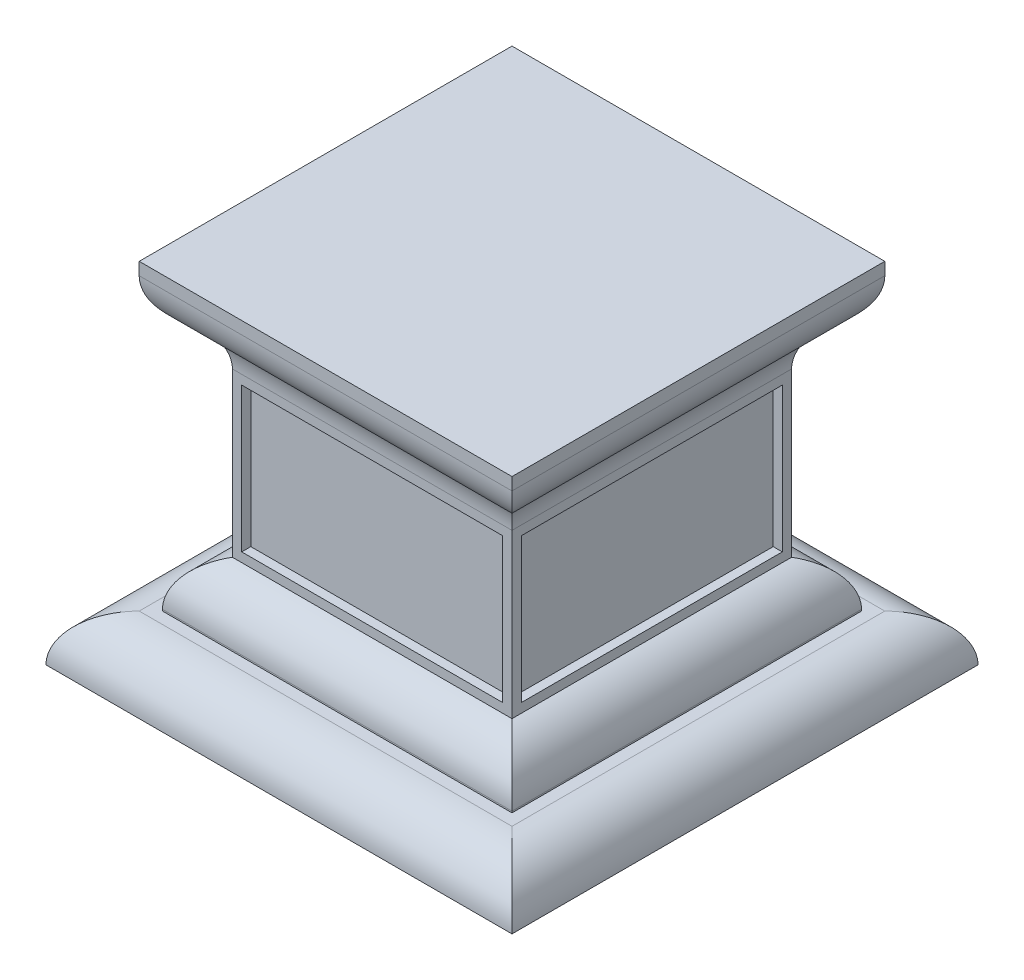
from build123d import *

# Parameters (mm, degrees)
SKETCH2_W           = 100
SKETCH2_H           = 100
BOSS_EXTRUDE1_DEPTH = 10
SKETCH3_W           = 75
SKETCH3_H           = 75
BOSS_EXTRUDE2_DEPTH = 10
SKETCH4_W           = 60
SKETCH4_H           = 60
BOSS_EXTRUDE3_DEPTH = 45
SKETCH5_W           = 80
SKETCH5_H           = 80
BOSS_EXTRUDE4_DEPTH = 10
FILLET2_R           = 10
FILLET1_R           = 10
FILLET3_R           = 10
SKETCH6_W           = 56
SKETCH6_H           = 31
CUT_EXTRUDE1_DEPTH  = 1.95
CIRPATTERN2_COUNT   = 4


# Some blends are built 0.0001 mm under size
with BuildPart() as part:
    # Sketch2 → Boss-Extrude1 (new body)
    with BuildSketch(Plane(origin=(0, 0, 0), x_dir=(1, 0, 0), z_dir=(0, 1, 0))):
        Rectangle(SKETCH2_W, SKETCH2_H)
    extrude(amount=BOSS_EXTRUDE1_DEPTH)

    # Sketch3 → Boss-Extrude2 (add)
    with BuildSketch(Plane(origin=(0, 10, 0), x_dir=(1, 0, 0), z_dir=(0, 1, 0))):
        Rectangle(SKETCH3_W, SKETCH3_H)
    extrude(amount=BOSS_EXTRUDE2_DEPTH)

    # Sketch4 → Boss-Extrude3 (add)
    with BuildSketch(Plane(origin=(0, 20, 0), x_dir=(1, 0, 0), z_dir=(0, 1, 0))):
        Rectangle(SKETCH4_W, SKETCH4_H)
    extrude(amount=BOSS_EXTRUDE3_DEPTH)

    # Sketch5 → Boss-Extrude4 (add)
    with BuildSketch(Plane(origin=(0, 65, 0), x_dir=(1, 0, 0), z_dir=(0, 1, 0))):
        Rectangle(SKETCH5_W, SKETCH5_H)
    extrude(amount=BOSS_EXTRUDE4_DEPTH)

    # Fillet2
    # the kernel refuses this fillet: 10 mm, written as the material it takes off along each edge
    with BuildSketch(Plane(origin=(-50, 10, 75), x_dir=(1, 0, 0), z_dir=(0, 0, -1)), Plane(origin=(75, 10, 50), x_dir=(0, 0, -1), z_dir=(-1, 0, 0)), Plane(origin=(-75, 10, -50), x_dir=(0, 0, 1), z_dir=(1, 0, 0)), Plane(origin=(50, 10, -75), x_dir=(-1, 0, 0), z_dir=(0, 0, 1))) as fillet2_piece_1:
        with BuildLine():
            CenterArc((FILLET2_R, FILLET2_R), FILLET2_R, 180, 90)
            Line((0, FILLET2_R), (-FILLET2_R * 0.02, FILLET2_R))
            Line((-FILLET2_R * 0.02, FILLET2_R), (-FILLET2_R * 0.02, -FILLET2_R * 0.02))
            Line((-FILLET2_R * 0.02, -FILLET2_R * 0.02), (FILLET2_R, -FILLET2_R * 0.02))
            Line((FILLET2_R, -FILLET2_R * 0.02), (FILLET2_R, 0))
        make_face()
    extrude(amount=150, mode=Mode.SUBTRACT)
    with BuildSketch(Plane(origin=(-37.5, 20, 61.706145914), x_dir=(1, 0, 0), z_dir=(0, 0, -1)), Plane(origin=(-61.706145914, 20, -37.5), x_dir=(0, 0, 1), z_dir=(1, 0, 0)), Plane(origin=(37.5, 20, -61.706145914), x_dir=(-1, 0, 0), z_dir=(0, 0, 1)), Plane(origin=(61.706145914, 20, 37.5), x_dir=(0, 0, -1), z_dir=(-1, 0, 0))) as fillet2_piece_2:
        with BuildLine():
            CenterArc((10, 9.682458366), FILLET2_R, 180, 75.522487814)
            Line((0, 9.682458366), (-0.2, 9.682458366))
            Line((-0.2, 9.682458366), (-0.2, 0))
            Line((-0.2, 0), (0, -0.2))
            ThreePointArc((0, -0.2), (3.75, -0.2), (7.45, -0.193649167))
            Line((7.45, -0.193649167), (7.5, 0))
        make_face()
    extrude(amount=123.412291828, mode=Mode.SUBTRACT)

    # Fillet1
    fillet1_edges = [part.edges().sort_by_distance(p)[0] for p in [
        (30, 65, 0),
        (0, 65, -30),
        (-30, 65, 0),
        (0, 65, 30),
    ]]
    fillet(fillet1_edges, radius=FILLET1_R - 0.0001)  # a hair under: the kernel refuses the full size

    # Fillet3
    # the kernel refuses this fillet: 10 mm, written as the material it takes off along each edge
    with BuildSketch(Plane(origin=(58.301375851, 65, 40), x_dir=(0, -0.25881282131019395, -0.9659274939277055), z_dir=(-1, 0, 0)), Plane(origin=(-40, 65, 58.301375851), x_dir=(0.9659274939277057, -0.2588128213101933, 0), z_dir=(0, 0, -1)), Plane(origin=(-58.301375851, 65, -40), x_dir=(0, -0.2588128213101933, 0.9659274939277057), z_dir=(1, 0, 0)), Plane(origin=(40, 65, -58.301375851), x_dir=(-0.9659274939277057, -0.2588128213101933, 0), z_dir=(0, 0, 1))) as fillet3_piece_1:
        with BuildLine():
            CenterArc((7.764622652, -9.659249058), FILLET3_R, 105.000203777, 60.000165399)
            Line((-1.894652287, -7.071120845), (-2.860579781, -6.812308023))
            Line((-2.860579781, -6.812308023), (-0.965927494, 0.258812821))
            Line((-0.965927494, 0.258812821), (0.258812821, 0.965927494))
            ThreePointArc((0.258812821, 0.965927494), (0.258909414, 0.965901613), (4.917575367, 0.965924906))
            Line((4.917575367, 0.965924906), (5.176397847, 0))
        make_face()
    extrude(amount=116.602751703, mode=Mode.SUBTRACT)

    # Sketch6 → Cut-Extrude1 (cut)
    with BuildSketch(Plane.XY.offset(30)):
        with Locations((0, 37.5)):
            Rectangle(SKETCH6_W, SKETCH6_H)
    cut_extrude1 = extrude(amount=-CUT_EXTRUDE1_DEPTH, mode=Mode.SUBTRACT)

    # CirPattern2: Cut-Extrude1 ×4 about axis
    cirpattern2_axis = Axis((0, 0, 0), (0, 1, 0))
    for i in range(1, CIRPATTERN2_COUNT):
        add(cut_extrude1.rotate(cirpattern2_axis, i * 360 / CIRPATTERN2_COUNT), mode=Mode.SUBTRACT)


solid = part.part
